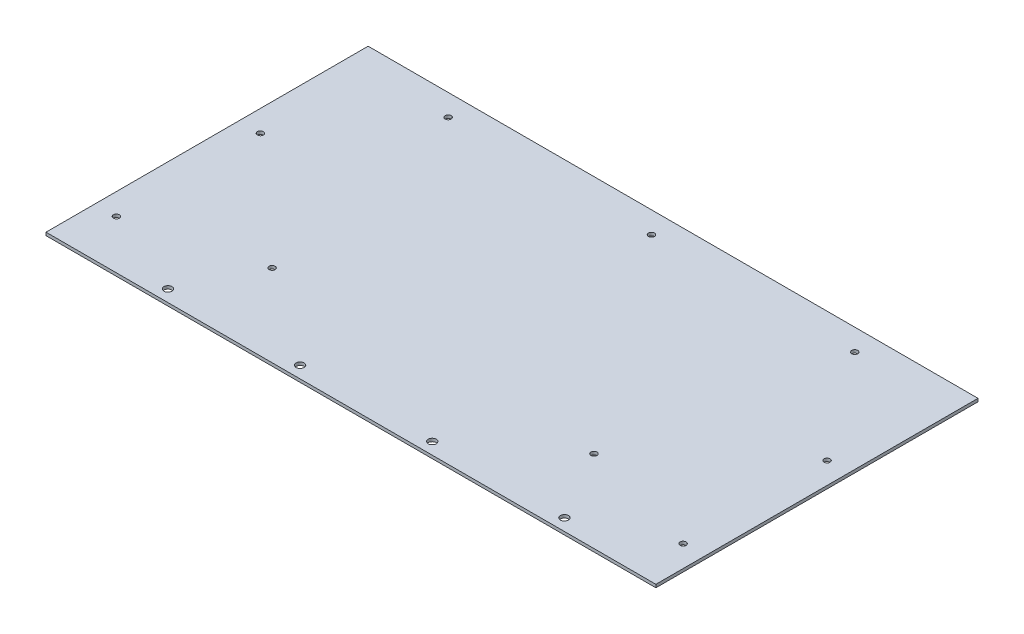
from build123d import *

# Parameters (mm, degrees)
SKETCH1_W            = 457.2
SKETCH1_H            = 2.286
BOSS_EXTRUDE1_DEPTH  = 238.315200026
SKETCH2_W            = 457.2
SKETCH2_H            = 2.286
BOSS_EXTRUDE2_DEPTH  = 3.175
SKETCH9_R            = 3
CUT_EXTRUDE10_DEPTH  = 2.54
LPATTERN1_COUNT      = 4
LPATTERN1_PITCH      = 99.06
M4_CLEARANCE_HOLE1_D = 4.5


with BuildPart() as part:
    # Sketch1 → Boss-Extrude1 (new body)
    with BuildSketch(Plane.XY):
        Rectangle(SKETCH1_W, SKETCH1_H)
    extrude(amount=BOSS_EXTRUDE1_DEPTH)

    # Sketch2 → Boss-Extrude2 (add)
    with BuildSketch(Plane(origin=(0, 0, 0), x_dir=(-1, 0, 0), z_dir=(0, 0, -1))):
        Rectangle(SKETCH2_W, SKETCH2_H)
    extrude(amount=BOSS_EXTRUDE2_DEPTH)

    # Sketch9 → Cut-Extrude10 (cut)
    with BuildSketch(Plane(origin=(0, 1.143, 0), x_dir=(1, 0, 0), z_dir=(0, 1, 0))):
        with Locations((-146.05, -229.425200026)):
            Circle(SKETCH9_R)
    cut_extrude10 = extrude(amount=-CUT_EXTRUDE10_DEPTH, mode=Mode.SUBTRACT)

    # LPattern1: Cut-Extrude10 ×4
    with Locations(*[(i * LPATTERN1_PITCH, 0, 0) for i in range(1, LPATTERN1_COUNT)]):
        add(cut_extrude10, mode=Mode.SUBTRACT)

    # M4 Clearance Hole1 (through all)
    with Locations(Plane.XZ.offset(1.143)):
        with Locations((-212.419, 93.774823778), (-152.4, 13.0175), (0, 13.0175), (152.4, 13.0175), (212.419, 93.774823778), (212.419, 201.724823778), (-212.419, 201.724823778), (-120.65, 176.776), (120.65, 176.776)):
            Hole(M4_CLEARANCE_HOLE1_D / 2)


solid = part.part
